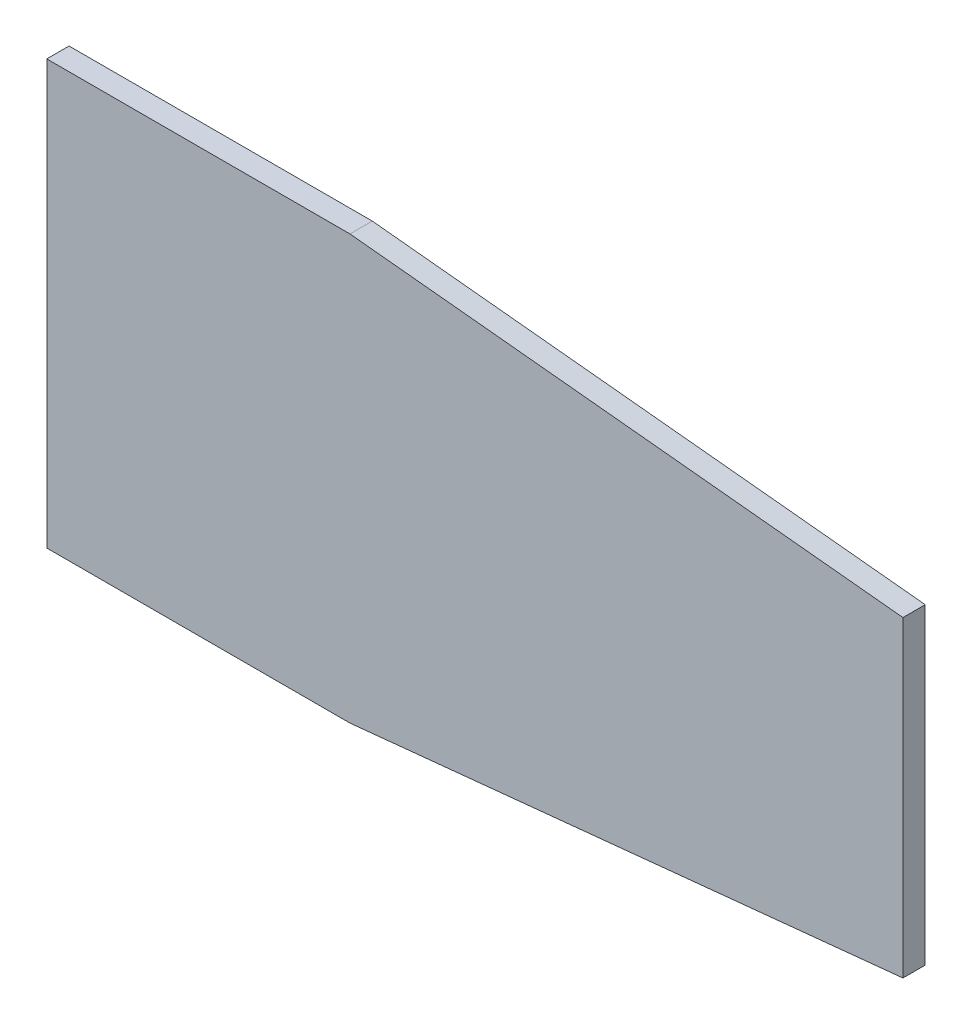
from build123d import *

# Parameters (mm, degrees)
AUFSATZ_LINEAR_AUSTRAGEN1_DEPTH = 5


with BuildPart() as part:
    # Skizze1 → Aufsatz-Linear austragen1 (new body)
    with BuildSketch(Plane.XY):
        Polygon((0, -47.5), (0, 47.5), (68, 47.5), (192, 35), (192, -35), (68, -47.5), align=None)
    extrude(amount=AUFSATZ_LINEAR_AUSTRAGEN1_DEPTH)


solid = part.part
